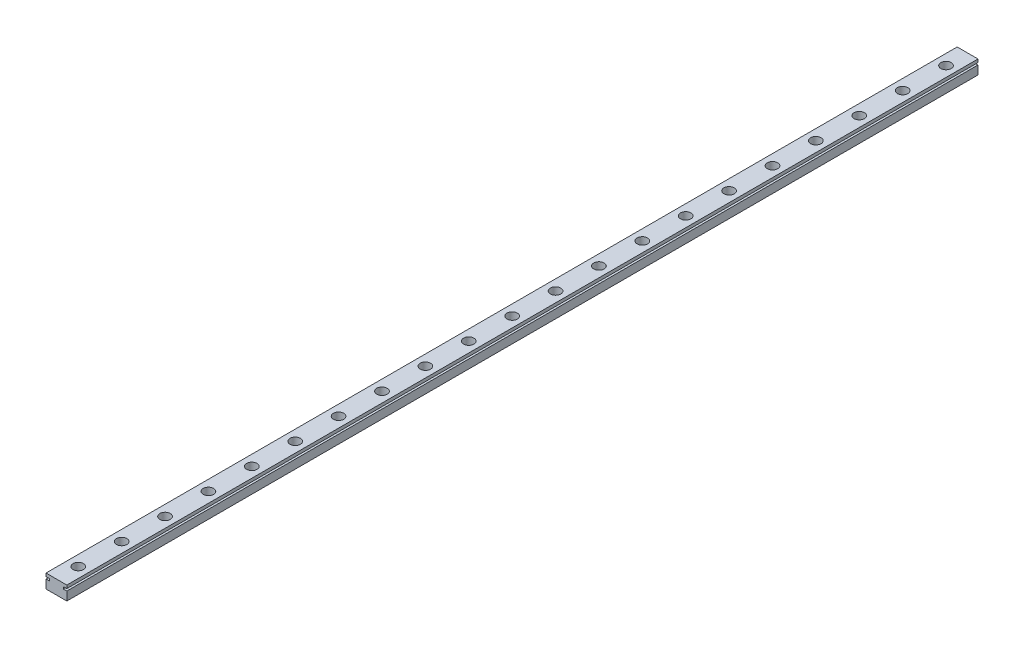
from build123d import *

# Parameters (mm, degrees)
BOSS_EXTRU_1_DEPTH      = 525
ESQUISSE2_R             = 3
ENL_V_MAT_EXTRU_1_DEPTH = 4.5
ENL_V_MAT_EXTRU_2_REACH = 527.109
ESQUISSE3_R             = 1.75


with BuildPart() as part:
    # Esquisse1 → Boss.-Extru.1 (new body)
    with BuildSketch(Plane.XY):
        Polygon((-2.287966089, -3.148854962), (9.712033911, -3.148854962), (9.712033911, 1.851145038), (7.712033911, 1.851145038), (7.712033911, 3.051145038), (9.712033911, 3.051145038), (9.712033911, 4.851145038), (-2.287966089, 4.851145038), (-2.287966089, 3.051145038), (-0.287966089, 3.051145038), (-0.287966089, 1.851145038), (-2.287966089, 1.851145038), align=None)
    extrude(amount=BOSS_EXTRU_1_DEPTH)

    # Esquisse2 → Enlèv. mat.-Extru.1 (cut)
    with BuildSketch(Plane(origin=(0, 4.851145038, 0), x_dir=(1, 0, 0), z_dir=(0, 1, 0))):
        with Locations((3.792841972, -512.5)):
            Circle(ESQUISSE2_R)
        with Locations((3.792841972, -487.5)):
            Circle(ESQUISSE2_R)
        with Locations((3.792841972, -462.5)):
            Circle(ESQUISSE2_R)
        with Locations((3.792841972, -437.5)):
            Circle(ESQUISSE2_R)
        with Locations((3.792841972, -412.5)):
            Circle(ESQUISSE2_R)
        with Locations((3.792841972, -387.5)):
            Circle(ESQUISSE2_R)
        with Locations((3.792841972, -362.5)):
            Circle(ESQUISSE2_R)
        with Locations((3.792841972, -337.5)):
            Circle(ESQUISSE2_R)
        with Locations((3.792841972, -312.5)):
            Circle(ESQUISSE2_R)
        with Locations((3.792841972, -287.5)):
            Circle(ESQUISSE2_R)
        with Locations((3.792841972, -262.5)):
            Circle(ESQUISSE2_R)
        with Locations((3.792841972, -237.5)):
            Circle(ESQUISSE2_R)
        with Locations((3.792841972, -212.5)):
            Circle(ESQUISSE2_R)
        with Locations((3.792841972, -187.5)):
            Circle(ESQUISSE2_R)
        with Locations((3.792841972, -162.5)):
            Circle(ESQUISSE2_R)
        with Locations((3.792841972, -137.5)):
            Circle(ESQUISSE2_R)
        with Locations((3.792841972, -112.5)):
            Circle(ESQUISSE2_R)
        with Locations((3.792841972, -87.5)):
            Circle(ESQUISSE2_R)
        with Locations((3.792841972, -62.5)):
            Circle(ESQUISSE2_R)
        with Locations((3.792841972, -37.5)):
            Circle(ESQUISSE2_R)
        with Locations((3.792841972, -12.5)):
            Circle(ESQUISSE2_R)
    extrude(amount=-ENL_V_MAT_EXTRU_1_DEPTH, mode=Mode.SUBTRACT)

    # Esquisse3 → Enlèv. mat.-Extru.2 (cut, up to next)
    with BuildSketch(Plane(origin=(0, 0.351145038, 0), x_dir=(1, 0, 0), z_dir=(0, 1, 0)), mode=Mode.PRIVATE) as enl_v_mat_extru_2_sk1:
        with Locations((3.792841972, -512.5)):
            Circle(ESQUISSE3_R)
    enl_v_mat_extru_2_tool1 = extrude(enl_v_mat_extru_2_sk1.sketch, amount=-ENL_V_MAT_EXTRU_2_REACH, mode=Mode.PRIVATE) & part.part
    # Esquisse3 → Enlèv. mat.-Extru.2 (cut, up to next)
    with BuildSketch(Plane(origin=(0, 0.351145038, 0), x_dir=(1, 0, 0), z_dir=(0, 1, 0)), mode=Mode.PRIVATE) as enl_v_mat_extru_2_sk2:
        with Locations((3.792841972, -487.5)):
            Circle(ESQUISSE3_R)
    enl_v_mat_extru_2_tool2 = extrude(enl_v_mat_extru_2_sk2.sketch, amount=-ENL_V_MAT_EXTRU_2_REACH, mode=Mode.PRIVATE) & part.part
    # Esquisse3 → Enlèv. mat.-Extru.2 (cut, up to next)
    with BuildSketch(Plane(origin=(0, 0.351145038, 0), x_dir=(1, 0, 0), z_dir=(0, 1, 0)), mode=Mode.PRIVATE) as enl_v_mat_extru_2_sk3:
        with Locations((3.792841972, -462.5)):
            Circle(ESQUISSE3_R)
    enl_v_mat_extru_2_tool3 = extrude(enl_v_mat_extru_2_sk3.sketch, amount=-ENL_V_MAT_EXTRU_2_REACH, mode=Mode.PRIVATE) & part.part
    # Esquisse3 → Enlèv. mat.-Extru.2 (cut, up to next)
    with BuildSketch(Plane(origin=(0, 0.351145038, 0), x_dir=(1, 0, 0), z_dir=(0, 1, 0)), mode=Mode.PRIVATE) as enl_v_mat_extru_2_sk4:
        with Locations((3.792841972, -437.5)):
            Circle(ESQUISSE3_R)
    enl_v_mat_extru_2_tool4 = extrude(enl_v_mat_extru_2_sk4.sketch, amount=-ENL_V_MAT_EXTRU_2_REACH, mode=Mode.PRIVATE) & part.part
    # Esquisse3 → Enlèv. mat.-Extru.2 (cut, up to next)
    with BuildSketch(Plane(origin=(0, 0.351145038, 0), x_dir=(1, 0, 0), z_dir=(0, 1, 0)), mode=Mode.PRIVATE) as enl_v_mat_extru_2_sk5:
        with Locations((3.792841972, -412.5)):
            Circle(ESQUISSE3_R)
    enl_v_mat_extru_2_tool5 = extrude(enl_v_mat_extru_2_sk5.sketch, amount=-ENL_V_MAT_EXTRU_2_REACH, mode=Mode.PRIVATE) & part.part
    # Esquisse3 → Enlèv. mat.-Extru.2 (cut, up to next)
    with BuildSketch(Plane(origin=(0, 0.351145038, 0), x_dir=(1, 0, 0), z_dir=(0, 1, 0)), mode=Mode.PRIVATE) as enl_v_mat_extru_2_sk6:
        with Locations((3.792841972, -387.5)):
            Circle(ESQUISSE3_R)
    enl_v_mat_extru_2_tool6 = extrude(enl_v_mat_extru_2_sk6.sketch, amount=-ENL_V_MAT_EXTRU_2_REACH, mode=Mode.PRIVATE) & part.part
    # Esquisse3 → Enlèv. mat.-Extru.2 (cut, up to next)
    with BuildSketch(Plane(origin=(0, 0.351145038, 0), x_dir=(1, 0, 0), z_dir=(0, 1, 0)), mode=Mode.PRIVATE) as enl_v_mat_extru_2_sk7:
        with Locations((3.792841972, -362.5)):
            Circle(ESQUISSE3_R)
    enl_v_mat_extru_2_tool7 = extrude(enl_v_mat_extru_2_sk7.sketch, amount=-ENL_V_MAT_EXTRU_2_REACH, mode=Mode.PRIVATE) & part.part
    # Esquisse3 → Enlèv. mat.-Extru.2 (cut, up to next)
    with BuildSketch(Plane(origin=(0, 0.351145038, 0), x_dir=(1, 0, 0), z_dir=(0, 1, 0)), mode=Mode.PRIVATE) as enl_v_mat_extru_2_sk8:
        with Locations((3.792841972, -337.5)):
            Circle(ESQUISSE3_R)
    enl_v_mat_extru_2_tool8 = extrude(enl_v_mat_extru_2_sk8.sketch, amount=-ENL_V_MAT_EXTRU_2_REACH, mode=Mode.PRIVATE) & part.part
    # Esquisse3 → Enlèv. mat.-Extru.2 (cut, up to next)
    with BuildSketch(Plane(origin=(0, 0.351145038, 0), x_dir=(1, 0, 0), z_dir=(0, 1, 0)), mode=Mode.PRIVATE) as enl_v_mat_extru_2_sk9:
        with Locations((3.792841972, -312.5)):
            Circle(ESQUISSE3_R)
    enl_v_mat_extru_2_tool9 = extrude(enl_v_mat_extru_2_sk9.sketch, amount=-ENL_V_MAT_EXTRU_2_REACH, mode=Mode.PRIVATE) & part.part
    # Esquisse3 → Enlèv. mat.-Extru.2 (cut, up to next)
    with BuildSketch(Plane(origin=(0, 0.351145038, 0), x_dir=(1, 0, 0), z_dir=(0, 1, 0)), mode=Mode.PRIVATE) as enl_v_mat_extru_2_sk10:
        with Locations((3.792841972, -287.5)):
            Circle(ESQUISSE3_R)
    enl_v_mat_extru_2_tool10 = extrude(enl_v_mat_extru_2_sk10.sketch, amount=-ENL_V_MAT_EXTRU_2_REACH, mode=Mode.PRIVATE) & part.part
    # Esquisse3 → Enlèv. mat.-Extru.2 (cut, up to next)
    with BuildSketch(Plane(origin=(0, 0.351145038, 0), x_dir=(1, 0, 0), z_dir=(0, 1, 0)), mode=Mode.PRIVATE) as enl_v_mat_extru_2_sk11:
        with Locations((3.792841972, -262.5)):
            Circle(ESQUISSE3_R)
    enl_v_mat_extru_2_tool11 = extrude(enl_v_mat_extru_2_sk11.sketch, amount=-ENL_V_MAT_EXTRU_2_REACH, mode=Mode.PRIVATE) & part.part
    # Esquisse3 → Enlèv. mat.-Extru.2 (cut, up to next)
    with BuildSketch(Plane(origin=(0, 0.351145038, 0), x_dir=(1, 0, 0), z_dir=(0, 1, 0)), mode=Mode.PRIVATE) as enl_v_mat_extru_2_sk12:
        with Locations((3.792841972, -237.5)):
            Circle(ESQUISSE3_R)
    enl_v_mat_extru_2_tool12 = extrude(enl_v_mat_extru_2_sk12.sketch, amount=-ENL_V_MAT_EXTRU_2_REACH, mode=Mode.PRIVATE) & part.part
    # Esquisse3 → Enlèv. mat.-Extru.2 (cut, up to next)
    with BuildSketch(Plane(origin=(0, 0.351145038, 0), x_dir=(1, 0, 0), z_dir=(0, 1, 0)), mode=Mode.PRIVATE) as enl_v_mat_extru_2_sk13:
        with Locations((3.792841972, -212.5)):
            Circle(ESQUISSE3_R)
    enl_v_mat_extru_2_tool13 = extrude(enl_v_mat_extru_2_sk13.sketch, amount=-ENL_V_MAT_EXTRU_2_REACH, mode=Mode.PRIVATE) & part.part
    # Esquisse3 → Enlèv. mat.-Extru.2 (cut, up to next)
    with BuildSketch(Plane(origin=(0, 0.351145038, 0), x_dir=(1, 0, 0), z_dir=(0, 1, 0)), mode=Mode.PRIVATE) as enl_v_mat_extru_2_sk14:
        with Locations((3.792841972, -187.5)):
            Circle(ESQUISSE3_R)
    enl_v_mat_extru_2_tool14 = extrude(enl_v_mat_extru_2_sk14.sketch, amount=-ENL_V_MAT_EXTRU_2_REACH, mode=Mode.PRIVATE) & part.part
    # Esquisse3 → Enlèv. mat.-Extru.2 (cut, up to next)
    with BuildSketch(Plane(origin=(0, 0.351145038, 0), x_dir=(1, 0, 0), z_dir=(0, 1, 0)), mode=Mode.PRIVATE) as enl_v_mat_extru_2_sk15:
        with Locations((3.792841972, -162.5)):
            Circle(ESQUISSE3_R)
    enl_v_mat_extru_2_tool15 = extrude(enl_v_mat_extru_2_sk15.sketch, amount=-ENL_V_MAT_EXTRU_2_REACH, mode=Mode.PRIVATE) & part.part
    # Esquisse3 → Enlèv. mat.-Extru.2 (cut, up to next)
    with BuildSketch(Plane(origin=(0, 0.351145038, 0), x_dir=(1, 0, 0), z_dir=(0, 1, 0)), mode=Mode.PRIVATE) as enl_v_mat_extru_2_sk16:
        with Locations((3.792841972, -137.5)):
            Circle(ESQUISSE3_R)
    enl_v_mat_extru_2_tool16 = extrude(enl_v_mat_extru_2_sk16.sketch, amount=-ENL_V_MAT_EXTRU_2_REACH, mode=Mode.PRIVATE) & part.part
    # Esquisse3 → Enlèv. mat.-Extru.2 (cut, up to next)
    with BuildSketch(Plane(origin=(0, 0.351145038, 0), x_dir=(1, 0, 0), z_dir=(0, 1, 0)), mode=Mode.PRIVATE) as enl_v_mat_extru_2_sk17:
        with Locations((3.792841972, -112.5)):
            Circle(ESQUISSE3_R)
    enl_v_mat_extru_2_tool17 = extrude(enl_v_mat_extru_2_sk17.sketch, amount=-ENL_V_MAT_EXTRU_2_REACH, mode=Mode.PRIVATE) & part.part
    # Esquisse3 → Enlèv. mat.-Extru.2 (cut, up to next)
    with BuildSketch(Plane(origin=(0, 0.351145038, 0), x_dir=(1, 0, 0), z_dir=(0, 1, 0)), mode=Mode.PRIVATE) as enl_v_mat_extru_2_sk18:
        with Locations((3.792841972, -87.5)):
            Circle(ESQUISSE3_R)
    enl_v_mat_extru_2_tool18 = extrude(enl_v_mat_extru_2_sk18.sketch, amount=-ENL_V_MAT_EXTRU_2_REACH, mode=Mode.PRIVATE) & part.part
    # Esquisse3 → Enlèv. mat.-Extru.2 (cut, up to next)
    with BuildSketch(Plane(origin=(0, 0.351145038, 0), x_dir=(1, 0, 0), z_dir=(0, 1, 0)), mode=Mode.PRIVATE) as enl_v_mat_extru_2_sk19:
        with Locations((3.792841972, -62.5)):
            Circle(ESQUISSE3_R)
    enl_v_mat_extru_2_tool19 = extrude(enl_v_mat_extru_2_sk19.sketch, amount=-ENL_V_MAT_EXTRU_2_REACH, mode=Mode.PRIVATE) & part.part
    # Esquisse3 → Enlèv. mat.-Extru.2 (cut, up to next)
    with BuildSketch(Plane(origin=(0, 0.351145038, 0), x_dir=(1, 0, 0), z_dir=(0, 1, 0)), mode=Mode.PRIVATE) as enl_v_mat_extru_2_sk20:
        with Locations((3.792841972, -37.5)):
            Circle(ESQUISSE3_R)
    enl_v_mat_extru_2_tool20 = extrude(enl_v_mat_extru_2_sk20.sketch, amount=-ENL_V_MAT_EXTRU_2_REACH, mode=Mode.PRIVATE) & part.part
    # Esquisse3 → Enlèv. mat.-Extru.2 (cut, up to next)
    with BuildSketch(Plane(origin=(0, 0.351145038, 0), x_dir=(1, 0, 0), z_dir=(0, 1, 0)), mode=Mode.PRIVATE) as enl_v_mat_extru_2_sk21:
        with Locations((3.792841972, -12.5)):
            Circle(ESQUISSE3_R)
    enl_v_mat_extru_2_tool21 = extrude(enl_v_mat_extru_2_sk21.sketch, amount=-ENL_V_MAT_EXTRU_2_REACH, mode=Mode.PRIVATE) & part.part
    add(enl_v_mat_extru_2_tool1.solids().sort_by_distance((3.792842, 0.351145, 512.5))[0], mode=Mode.SUBTRACT)
    add(enl_v_mat_extru_2_tool2.solids().sort_by_distance((3.792842, 0.351145, 487.5))[0], mode=Mode.SUBTRACT)
    add(enl_v_mat_extru_2_tool3.solids().sort_by_distance((3.792842, 0.351145, 462.5))[0], mode=Mode.SUBTRACT)
    add(enl_v_mat_extru_2_tool4.solids().sort_by_distance((3.792842, 0.351145, 437.5))[0], mode=Mode.SUBTRACT)
    add(enl_v_mat_extru_2_tool5.solids().sort_by_distance((3.792842, 0.351145, 412.5))[0], mode=Mode.SUBTRACT)
    add(enl_v_mat_extru_2_tool6.solids().sort_by_distance((3.792842, 0.351145, 387.5))[0], mode=Mode.SUBTRACT)
    add(enl_v_mat_extru_2_tool7.solids().sort_by_distance((3.792842, 0.351145, 362.5))[0], mode=Mode.SUBTRACT)
    add(enl_v_mat_extru_2_tool8.solids().sort_by_distance((3.792842, 0.351145, 337.5))[0], mode=Mode.SUBTRACT)
    add(enl_v_mat_extru_2_tool9.solids().sort_by_distance((3.792842, 0.351145, 312.5))[0], mode=Mode.SUBTRACT)
    add(enl_v_mat_extru_2_tool10.solids().sort_by_distance((3.792842, 0.351145, 287.5))[0], mode=Mode.SUBTRACT)
    add(enl_v_mat_extru_2_tool11.solids().sort_by_distance((3.792842, 0.351145, 262.5))[0], mode=Mode.SUBTRACT)
    add(enl_v_mat_extru_2_tool12.solids().sort_by_distance((3.792842, 0.351145, 237.5))[0], mode=Mode.SUBTRACT)
    add(enl_v_mat_extru_2_tool13.solids().sort_by_distance((3.792842, 0.351145, 212.5))[0], mode=Mode.SUBTRACT)
    add(enl_v_mat_extru_2_tool14.solids().sort_by_distance((3.792842, 0.351145, 187.5))[0], mode=Mode.SUBTRACT)
    add(enl_v_mat_extru_2_tool15.solids().sort_by_distance((3.792842, 0.351145, 162.5))[0], mode=Mode.SUBTRACT)
    add(enl_v_mat_extru_2_tool16.solids().sort_by_distance((3.792842, 0.351145, 137.5))[0], mode=Mode.SUBTRACT)
    add(enl_v_mat_extru_2_tool17.solids().sort_by_distance((3.792842, 0.351145, 112.5))[0], mode=Mode.SUBTRACT)
    add(enl_v_mat_extru_2_tool18.solids().sort_by_distance((3.792842, 0.351145, 87.5))[0], mode=Mode.SUBTRACT)
    add(enl_v_mat_extru_2_tool19.solids().sort_by_distance((3.792842, 0.351145, 62.5))[0], mode=Mode.SUBTRACT)
    add(enl_v_mat_extru_2_tool20.solids().sort_by_distance((3.792842, 0.351145, 37.5))[0], mode=Mode.SUBTRACT)
    add(enl_v_mat_extru_2_tool21.solids().sort_by_distance((3.792842, 0.351145, 12.5))[0], mode=Mode.SUBTRACT)


solid = part.part
